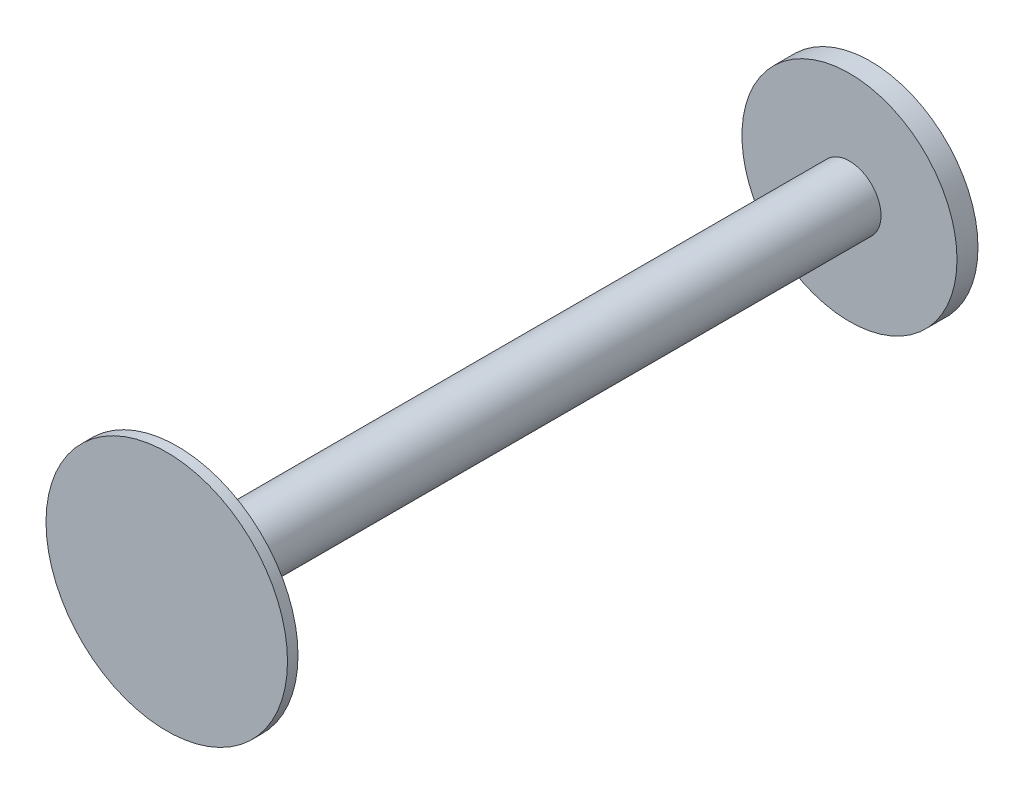
from build123d import *

# Parameters (mm, degrees)
SKETCH1_R           = 32.5
BOSS_EXTRUDE1_DEPTH = 6.35
SKETCH2_R           = 9.525
BOSS_EXTRUDE2_DEPTH = 203.2
SKETCH3_R           = 36.5
BOSS_EXTRUDE3_DEPTH = 3.175


with BuildPart() as part:
    # Sketch1 → Boss-Extrude1 (new body)
    with BuildSketch(Plane.XY):
        Circle(SKETCH1_R)
    extrude(amount=BOSS_EXTRUDE1_DEPTH)

    # Sketch2 → Boss-Extrude2 (add)
    with BuildSketch(Plane.XY.offset(6.35)):
        Circle(SKETCH2_R)
    extrude(amount=BOSS_EXTRUDE2_DEPTH)

    # Sketch3 → Boss-Extrude3 (add)
    with BuildSketch(Plane.XY.offset(209.55)):
        Circle(SKETCH3_R)
    extrude(amount=BOSS_EXTRUDE3_DEPTH)


solid = part.part
